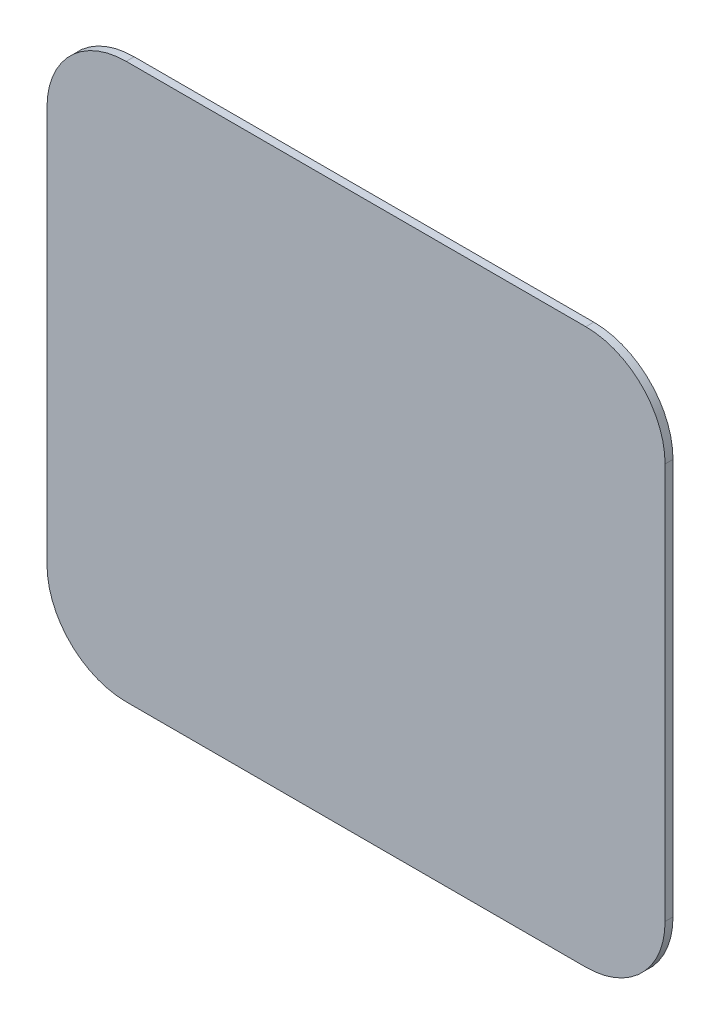
from build123d import *

# Parameters (mm, degrees)
SKETCH1_W           = 78
SKETCH1_H           = 70
BOSS_EXTRUDE1_DEPTH = 1
FILLET1_R           = 10
SKETCH2_R           = 5
CUT_EXTRUDE1_DEPTH  = 0.1


with BuildPart() as part:
    # Sketch1 → Boss-Extrude1 (new body)
    with BuildSketch(Plane.XY):
        with Locations((-0.075399098, 4.950190099)):
            Rectangle(SKETCH1_W, SKETCH1_H)
    extrude(amount=BOSS_EXTRUDE1_DEPTH)

    # Fillet1
    fillet1_edges = [part.edges().sort_by_distance(p)[0] for p in [
        (-39.075399098, 39.950190099, 0.5),
        (-39.075399098, -30.049809901, 0.5),
        (38.924600902, -30.049809901, 0.5),
        (38.924600902, 39.950190099, 0.5),
    ]]
    fillet(fillet1_edges, radius=FILLET1_R)

    # Sketch2 → Cut-Extrude1 (cut)
    with BuildSketch(Plane(origin=(0, 0, 0), x_dir=(-1, 0, 0), z_dir=(0, 0, -1))):
        with BuildLine():
            Line((-17.602270432, 22.627859629), (-21.137804338, 26.163393535))
            ThreePointArc((-21.137804338, 26.163393535), (-29.924600902, 4.950190099), (-21.137804338, -16.263013337))
            Line((-21.137804338, -16.263013337), (-17.602270432, -12.727479431))
            ThreePointArc((-17.602270432, -12.727479431), (-24.924600902, 4.950190099), (-17.602270432, 22.627859629))
        make_face()
        with BuildLine():
            ThreePointArc((21.288602533, -16.263013337), (30.075399098, 4.950190099), (21.288602533, 26.163393535))
            Line((21.288602533, 26.163393535), (17.753068627, 22.627859629))
            ThreePointArc((17.753068627, 22.627859629), (25.075399098, 4.950190099), (17.753068627, -12.727479431))
            Line((17.753068627, -12.727479431), (21.288602533, -16.263013337))
        make_face()
        with BuildLine():
            ThreePointArc((12.449767768, -7.424178572), (17.575399098, 4.950190099), (12.449767768, 17.32455877))
            Line((12.449767768, 17.32455877), (8.914233862, 13.789024864))
            ThreePointArc((8.914233862, 13.789024864), (12.575399098, 4.950190099), (8.914233862, -3.888644666))
            Line((8.914233862, -3.888644666), (12.449767768, -7.424178572))
        make_face()
        with BuildLine():
            Line((-8.763435667, 13.789024864), (-12.298969573, 17.32455877))
            ThreePointArc((-12.298969573, 17.32455877), (-17.424600902, 4.950190099), (-12.298969573, -7.424178572))
            Line((-12.298969573, -7.424178572), (-8.763435667, -3.888644666))
            ThreePointArc((-8.763435667, -3.888644666), (-12.424600902, 4.950190099), (-8.763435667, 13.789024864))
        make_face()
        with Locations((0.075399098, 4.950190099)):
            Circle(SKETCH2_R)
    extrude(amount=-CUT_EXTRUDE1_DEPTH, mode=Mode.SUBTRACT)


solid = part.part
